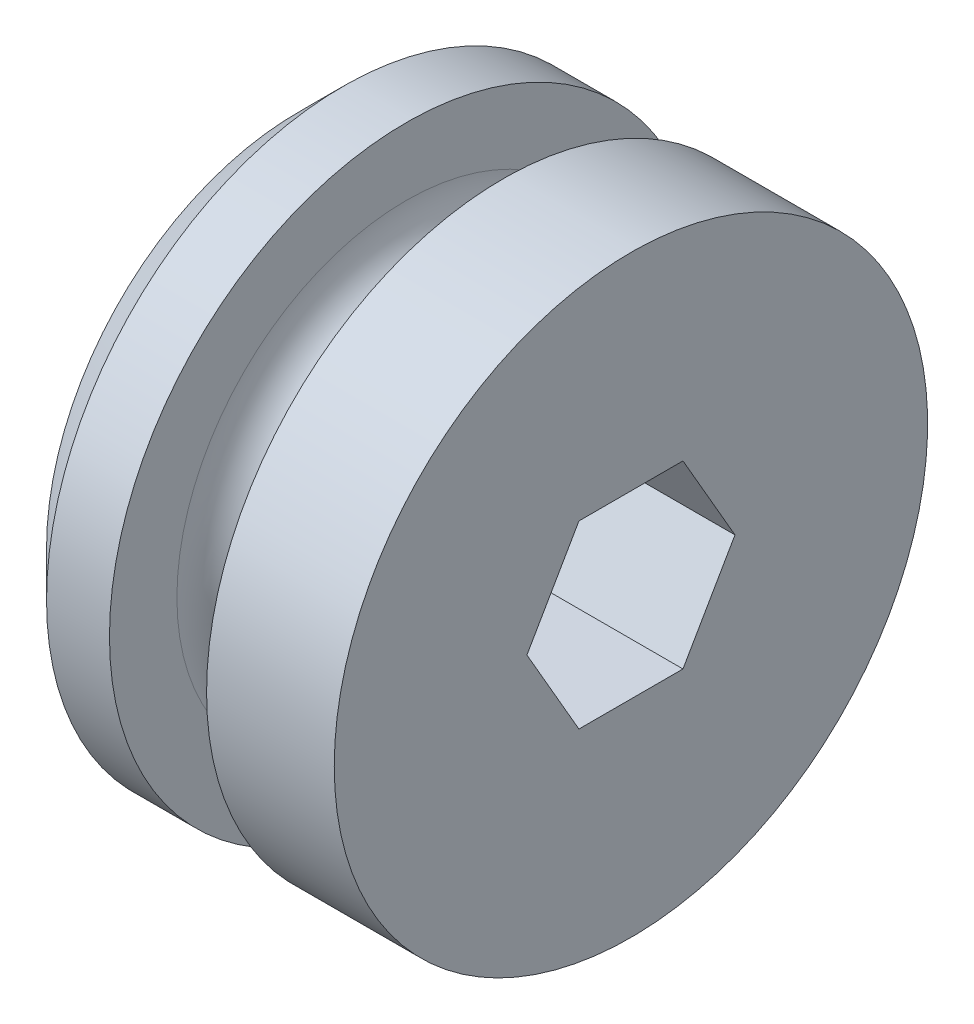
from build123d import *

# Parameters (mm, degrees)
CHAMFER1_SIZE      = 3.175
CUT_EXTRUDE1_DEPTH = 38.818501755


with BuildPart() as part:
    # Sketch1 → Revolve1 (revolve)
    with BuildSketch(Plane.XY):
        with BuildLine():
            Line((0, 0), (23.495, 0))
            Line((23.495, 0), (23.495, 20.955))
            Line((23.495, 20.955), (14.478, 20.955))
            Line((14.478, 20.955), (14.478, 16.1925))
            ThreePointArc((14.478, 16.1925), (11.049, 12.7635), (7.62, 16.1925))
            Line((7.62, 16.1925), (7.62, 20.955))
            Line((7.62, 20.955), (0, 20.955))
            Line((0, 20.955), (0, 0))
        make_face()
    revolve(axis=Axis((0, 0, 0), (1, 0, 0)))

    # Chamfer1
    chamfer1_edges = [part.edges().sort_by_distance(p)[0] for p in [
        (0, -20.955, 0),
    ]]
    chamfer(chamfer1_edges, length=CHAMFER1_SIZE)

    # Sketch2 → Cut-Extrude1 (cut, through all)
    with BuildSketch(Plane.ZY):
        Polygon((3.673506558, -6.3627), (7.347013116, 0), (3.673506558, 6.3627), (-3.673506558, 6.3627), (-7.347013116, 0), (-3.673506558, -6.3627), align=None)
    extrude(amount=-CUT_EXTRUDE1_DEPTH, mode=Mode.SUBTRACT)


solid = part.part
